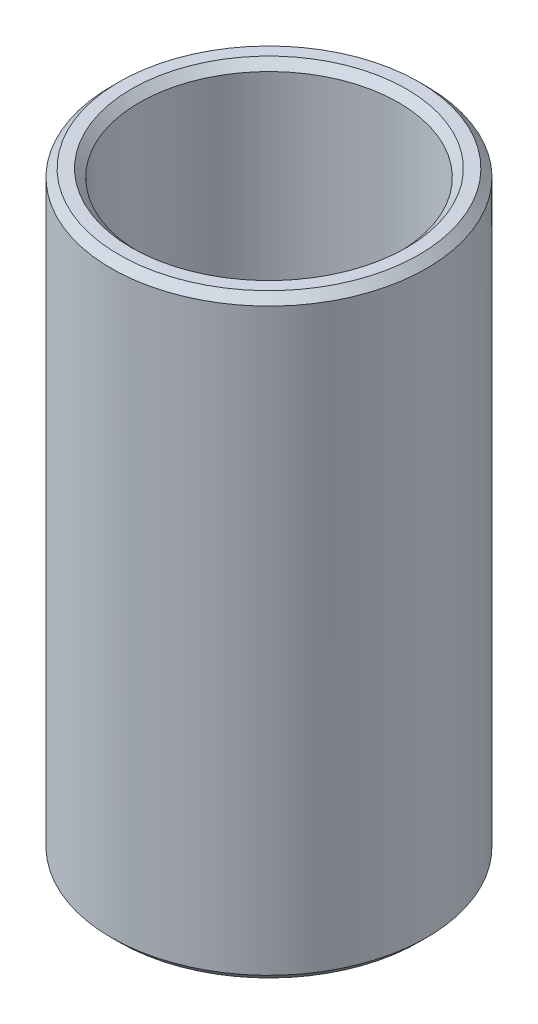
from build123d import *

# Parameters (mm, degrees)
SKETCH1_R           = 52.5
BOSS_EXTRUDE1_DEPTH = 198.173665641
SKETCH2_R           = 43.169229973
CUT_EXTRUDE1_DEPTH  = 212.625380693
CHAMFER1_SIZE       = 2.612136119


with BuildPart() as part:
    # Sketch1 → Boss-Extrude1 (new body)
    with BuildSketch(Plane(origin=(0, 0, 0), x_dir=(1, 0, 0), z_dir=(0, 1, 0))):
        Circle(SKETCH1_R)
    extrude(amount=BOSS_EXTRUDE1_DEPTH)

    # Sketch2 → Cut-Extrude1 (cut, through all)
    with BuildSketch(Plane(origin=(0, 0, 0), x_dir=(1, 0, 0), z_dir=(0, 1, 0))):
        Circle(SKETCH2_R)
    extrude(amount=CUT_EXTRUDE1_DEPTH, mode=Mode.SUBTRACT)

    # Chamfer1
    chamfer1_edges = [part.edges().sort_by_distance(p)[0] for p in [
        (-43.169229973, 198.173665641, 0),
        (-43.169229973, 0, 0),
        (-52.5, 0, 0),
        (-52.5, 198.173665641, 0),
    ]]
    chamfer(chamfer1_edges, length=CHAMFER1_SIZE)


solid = part.part
